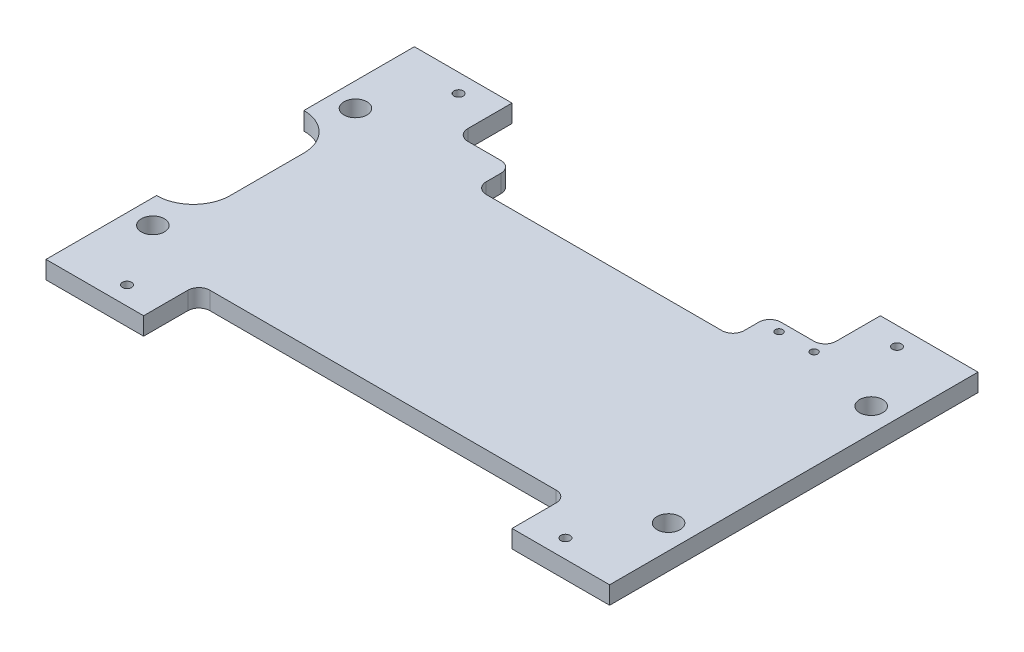
from build123d import *

# Parameters (mm, degrees)
SKETCH1_W           = 153
SKETCH1_H           = 100
BOSS_EXTRUDE1_DEPTH = 4.826
SKETCH2_W           = 100
SKETCH2_H           = 15
CUT_EXTRUDE1_DEPTH  = 92.517977884
SKETCH3_R           = 3.125
SKETCH3_R_2         = 1.25
CUT_EXTRUDE2_DEPTH  = 92.517977884
SKETCH5_W           = 10
SKETCH5_H           = 40
CUT_EXTRUDE3_DEPTH  = 92.517977884
SKETCH6_R           = 1
SKETCH6_W           = 70
SKETCH6_H           = 10
CUT_EXTRUDE4_DEPTH  = 92.517977884
FILLET1_R           = 3
FILLET2_R           = 10


with BuildPart() as part:
    # Sketch1 → Boss-Extrude1 (new body)
    with BuildSketch(Plane(origin=(0, 0, 0), x_dir=(1, 0, 0), z_dir=(0, 1, 0))):
        Rectangle(SKETCH1_W, SKETCH1_H)
    extrude(amount=BOSS_EXTRUDE1_DEPTH)

    # Sketch2 → Cut-Extrude1 (cut, through all)
    with BuildSketch(Plane(origin=(0, 4.826, 0), x_dir=(1, 0, 0), z_dir=(0, 1, 0))):
        with Locations((0, 42.5)):
            Rectangle(SKETCH2_W, SKETCH2_H)
        with Locations((0, -42.5)):
            Rectangle(SKETCH2_W, SKETCH2_H)
    extrude(amount=-CUT_EXTRUDE1_DEPTH, mode=Mode.SUBTRACT)

    # Sketch3 → Cut-Extrude2 (cut, through all)
    with BuildSketch(Plane(origin=(0, 4.826, 0), x_dir=(1, 0, 0), z_dir=(0, 1, 0))):
        with Locations(Location((-70, 27.5, 0), (0, 0, 270))):
            Circle(SKETCH3_R)
        with Locations(Location((-70, -27.5, 0), (0, 0, 90))):
            Circle(SKETCH3_R)
        with Locations(Location((70, -27.5, 0), (0, 0, 270))):
            Circle(SKETCH3_R)
        with Locations(Location((70, 27.5, 0), (0, 0, 90))):
            Circle(SKETCH3_R)
        with Locations(Location((-59.5, 45, 0), (0, 0, 270))):
            Circle(SKETCH3_R_2)
        with Locations(Location((-59.5, -45, 0), (0, 0, 90))):
            Circle(SKETCH3_R_2)
        with Locations(Location((59.5, 45, 0), (0, 0, 90))):
            Circle(SKETCH3_R_2)
        with Locations(Location((59.5, -45, 0), (0, 0, 270))):
            Circle(SKETCH3_R_2)
    extrude(amount=-CUT_EXTRUDE2_DEPTH, mode=Mode.SUBTRACT)

    # Sketch5 → Cut-Extrude3 (cut, through all)
    with BuildSketch(Plane(origin=(0, 4.826, 0), x_dir=(1, 0, 0), z_dir=(0, 1, 0))):
        with Locations((-71.5, 0)):
            Rectangle(SKETCH5_W, SKETCH5_H)
    extrude(amount=-CUT_EXTRUDE3_DEPTH, mode=Mode.SUBTRACT)

    # Sketch6 → Cut-Extrude4 (cut, through all)
    with BuildSketch(Plane(origin=(0, 4.826, 0), x_dir=(1, 0, 0), z_dir=(0, 1, 0))):
        with Locations(Location((40, 32.5, 0), (0, 0, 270))):
            Circle(SKETCH6_R)
        with Locations(Location((49.5, 32.5, 0), (0, 0, 270))):
            Circle(SKETCH6_R)
        with Locations((0, 30)):
            Rectangle(SKETCH6_W, SKETCH6_H)
    extrude(amount=-CUT_EXTRUDE4_DEPTH, mode=Mode.SUBTRACT)

    # Fillet1
    fillet1_edges = [part.edges().sort_by_distance(p)[0] for p in [
        (-35, 2.413, -25),
        (-35, 2.413, -35),
        (35, 2.413, -35),
        (35, 2.413, -25),
        (-50, 2.413, -35),
        (50, 2.413, -35),
        (-50, 2.413, 35),
        (50, 2.413, 35),
    ]]
    fillet(fillet1_edges, radius=FILLET1_R)

    # Fillet2
    fillet2_edges = [part.edges().sort_by_distance(p)[0] for p in [
        (-66.5, 2.413, 20),
        (-66.5, 2.413, -20),
    ]]
    fillet(fillet2_edges, radius=FILLET2_R - 0.0001)  # a hair under: the kernel refuses the full size


solid = part.part
